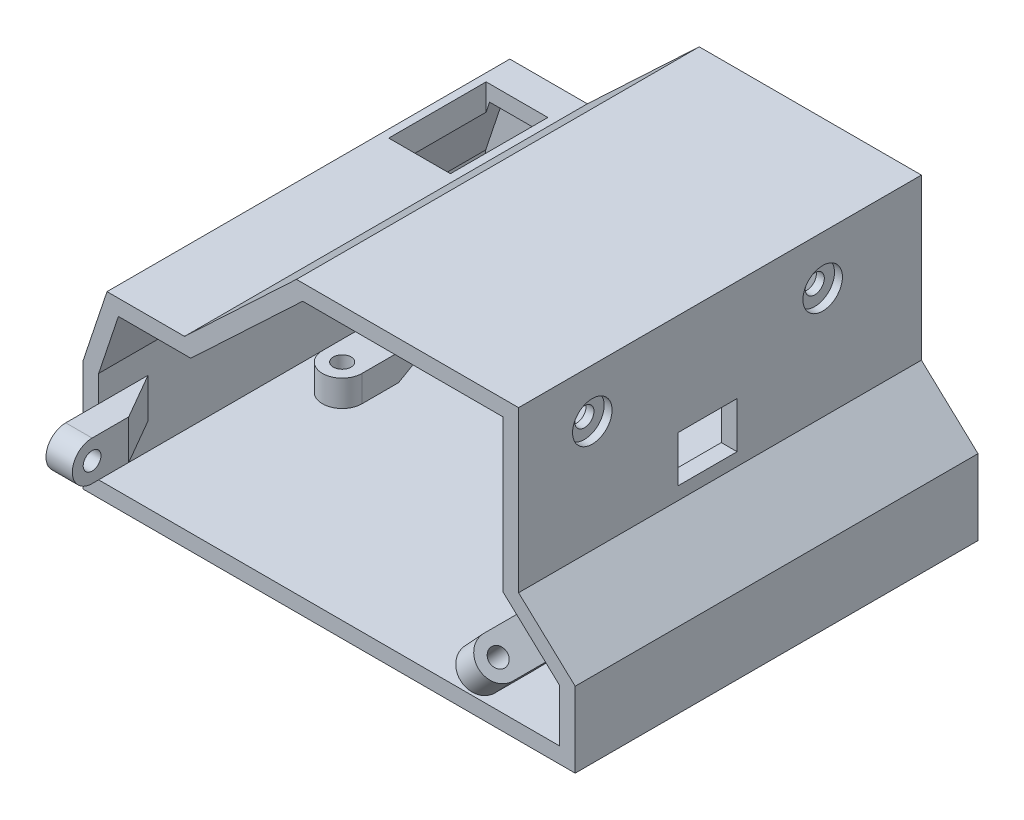
from build123d import *
from OCP.BRepFilletAPI import BRepFilletAPI_MakeChamfer

# Parameters (mm, degrees)
BOSS_EXTRUDE1_DEPTH                                = 104
SHELL1_START                                       = -8.6
SHELL1_OUTLINE_W                                   = 16
SHELL1_OUTLINE_H                                   = 108.8
SHELL1_DEPTH                                       = 2.4
SHELL1_START_2                                     = -56.951785259
SHELL1_2_OUTLINE_W                                 = 43.8
SHELL1_2_OUTLINE_H                                 = 108.8
SHELL1_2_DEPTH                                     = 50.751785259
SHELL1_START_3                                     = -72.4
SHELL1_3_OUTLINE_W                                 = 27.8
SHELL1_3_OUTLINE_H                                 = 108.8
SHELL1_3_DEPTH                                     = 74.8
SHELL1_4_DEPTH                                     = 104
SHELL1_START_4                                     = -2.4
SHELL1_5_DEPTH                                     = 108.8
SPLIT1_SURFACE_1_BACK                              = 140.108
SPLIT1_SURFACE_1_DEPTH                             = 280.216
SPLIT1_SURFACE_2_BACK                              = 140.108
SPLIT1_SURFACE_2_DEPTH                             = 280.216
BOSS_EXTRUDE2_DEPTH                                = 4
BOSS_EXTRUDE3_DEPTH                                = 4
BOSS_EXTRUDE4_DEPTH                                = 4
CHAMFER1_SIZE                                      = 4
CHAMFER1_SIZE_2                                    = 6.92820323
CBORE_START                                        = 6.157493905
CBORE_FOR_M2_5_PAN_HEAD_MACHINE_SCRE_2_R           = 3
CBORE_FOR_M2_5_PAN_HEAD_MACHINE_SCREW1_4_DEPTH     = 2.1
CBORE_START_2                                      = 5.857493905
CBORE_FOR_M2_5_PAN_HEAD_MACHINE_SCRE_3_R           = 1.35
CBORE_FOR_M2_5_PAN_HEAD_MACHINE_SCREW1_5_DEPTH     = 0.3
CBORE_START_3                                      = 39.3
CBORE_FOR_M2_5_PAN_HEAD_MACHINE_SCRE_4_R           = 3
CBORE_FOR_M2_5_PAN_HEAD_MACHINE_SCREW1_6_DEPTH     = 2.1
CBORE_START_4                                      = 38
CBORE_FOR_M2_5_PAN_HEAD_MACHINE_SCRE_5_R           = 1.35
CBORE_FOR_M2_5_PAN_HEAD_MACHINE_SCREW1_7_DEPTH     = 1.3
CBORE_START_5                                      = -72.4
CBORE_FOR_M2_5_PAN_HEAD_MACHINE_SCRE_6_R           = 3
CBORE_FOR_M2_5_PAN_HEAD_MACHINE_SCREW1_8_DEPTH     = 2.1
CBORE_START_6                                      = -70.3
CBORE_FOR_M2_5_PAN_HEAD_MACHINE_SCRE_7_R           = 1.35
CBORE_FOR_M2_5_PAN_HEAD_MACHINE_SCREW1_9_DEPTH     = 0.3
CUT_EXTRUDE1_REACH                                 = 104.356
SKETCH12_W                                         = 9.37803524
SKETCH12_H                                         = 14.8
CUT_EXTRUDE2_REACH                                 = 110.495
SKETCH13_W                                         = 14.8
SKETCH13_H                                         = 10.789494281
CUT_EXTRUDE3_REACH                                 = 104.755
SKETCH14_W                                         = 9
SKETCH14_H                                         = 7
CBORE_FOR_M2_5_PAN_HEAD_MACHINE_SCREW2_D           = 2.9
CBORE_FOR_M2_5_PAN_HEAD_MACHINE_SCREW2_DEPTH       = 10
CBORE_FOR_M2_5_PAN_HEAD_MACHINE_SCREW2_CBORE_D     = 6
CBORE_FOR_M2_5_PAN_HEAD_MACHINE_SCREW2_CBORE_DEPTH = 1.2


with BuildPart() as part:
    # Sketch1 → Boss-Extrude1 (new body)
    with BuildSketch(Plane.XY):
        Polygon((-39, 39), (-56, 23), (-67, 23), (-70, 14.000026796), (-70, 0), (0, 0), (0, 8), (-8.6, 16), (-8.6, 39), align=None)
    extrude(amount=BOSS_EXTRUDE1_DEPTH)

    # Shell1: read off the stored shape, not the designer's step
    # Shell1 outline → Shell1 (add)
    with BuildSketch(Plane.YZ.offset(SHELL1_START)):
        with Locations((33.4, 52)):
            Rectangle(SHELL1_OUTLINE_W, SHELL1_OUTLINE_H)
    extrude(amount=SHELL1_DEPTH)

    # Shell1 2 outline → Shell1 2 (add)
    with BuildSketch(Plane.YZ.offset(SHELL1_START_2)):
        with Locations((19.5, 52)):
            Rectangle(SHELL1_2_OUTLINE_W, SHELL1_2_OUTLINE_H)
    extrude(amount=SHELL1_2_DEPTH)

    # Shell1 3 outline → Shell1 3 (add)
    with BuildSketch(Plane.YZ.offset(SHELL1_START_3)):
        with Locations((11.5, 52)):
            Rectangle(SHELL1_3_OUTLINE_W, SHELL1_3_OUTLINE_H)
    extrude(amount=SHELL1_3_DEPTH)

    # Shell1 4 outline → Shell1 4 (cut)
    with BuildSketch(Plane.XY):
        Polygon((-6.2, 25.4), (-6.2, 17.045294183), (2.4, 9.045294183), (2.4, 25.4), align=None)
        Polygon((-72.4, 14.389494281), (-68.729820499, 25.4), (-72.4, 25.4), align=None)
        Polygon((-56.951785259, 25.4), (-39.951785259, 41.4), (-56.951785259, 41.4), align=None)
        Polygon((0, 0), (0, 8), (-8.6, 16), (-8.6, 39), (-39, 39), (-56, 23), (-67, 23), (-70, 14.000026796), (-70, 0), align=None)
    extrude(amount=SHELL1_4_DEPTH, mode=Mode.SUBTRACT)

    # Shell1 5 outline → Shell1 5 (cut)
    with BuildSketch(Plane.XY.offset(SHELL1_START_4)):
        Polygon((-6.2, 25.4), (-6.2, 17.045294183), (2.4, 9.045294183), (2.4, 25.4), align=None)
        Polygon((-72.4, 14.389494281), (-68.729820499, 25.4), (-72.4, 25.4), align=None)
        Polygon((-56.951785259, 25.4), (-39.951785259, 41.4), (-56.951785259, 41.4), align=None)
    extrude(amount=SHELL1_5_DEPTH, mode=Mode.SUBTRACT)


with BuildPart() as body_2:
    # Split1: the piece behind the surface
    add(part.part)
    # Split1 surface: a surface, the sketch's curves swept straight by 280.216 mm
    with BuildLine(Plane(origin=(0, 0, 0), x_dir=(0, 0, -1), z_dir=(1, 0, 0)).offset(-SPLIT1_SURFACE_1_BACK), mode=Mode.PRIVATE) as split1_surface_1_path:
        Line((-58.8, -2.4), (-58.8, 41.4))
    split1_surface_1 = Shell.extrude(split1_surface_1_path.wire(), (1 * SPLIT1_SURFACE_1_DEPTH, 0 * SPLIT1_SURFACE_1_DEPTH, 0 * SPLIT1_SURFACE_1_DEPTH))
    split(bisect_by=split1_surface_1, keep=Keep.BOTTOM)

    # Sketch3 → Boss-Extrude2 (add)
    with BuildSketch(Plane(origin=(3.989562192, 4.288779356, 0), x_dir=(0.7321867381630838, -0.6811039424772873, 0), z_dir=(-0.6811039424772873, -0.7321867381630838, 0))):
        with BuildLine():
            Line((-14.321650284, 51.3), (-8.321650284, 51.3))
            Line((-8.321650284, 51.3), (-8.321650284, 63.8))
            ThreePointArc((-8.321650284, 63.8), (-11.321650284, 66.8), (-14.321650284, 63.8))
            Line((-14.321650284, 63.8), (-14.321650284, 51.3))
        make_face()
    extrude(amount=BOSS_EXTRUDE2_DEPTH)

    # Sketch4 → Boss-Extrude3 (add)
    with BuildSketch(Plane.XZ.offset(-39)):
        with BuildLine():
            Line((-31, 51.3), (-25, 51.3))
            Line((-25, 51.3), (-25, 63.8))
            ThreePointArc((-25, 63.8), (-28, 66.8), (-31, 63.8))
            Line((-31, 63.8), (-31, 51.3))
        make_face()
    extrude(amount=BOSS_EXTRUDE3_DEPTH)

    # Sketch5 → Boss-Extrude4 (add)
    with BuildSketch(Plane(origin=(-70, 0, 0), x_dir=(0, 0, -1), z_dir=(1, 0, 0))):
        with BuildLine():
            Line((-51.3, 10.000013398), (-63.8, 10.000013398))
            ThreePointArc((-63.8, 10.000013398), (-66.8, 7.000013398), (-63.8, 4.000013398))
            Line((-63.8, 4.000013398), (-51.3, 4.000013398))
            Line((-51.3, 4.000013398), (-51.3, 10.000013398))
        make_face()
    extrude(amount=BOSS_EXTRUDE4_DEPTH)

    # Chamfer1
    chamfer1_edges_1 = [body_2.edges().sort_by_distance(p)[0] for p in [
        (-7.02441577, 9.071253047, 51.3),
    ]]
    chamfer1_side_1 = [body_2.faces().sort_by_distance(p)[0] for p in [
        (-6.969927455, 9.129827986, 51.3),
    ]]
    chamfer1_edges_2 = [body_2.edges().sort_by_distance(p)[0] for p in [
        (-28, 35, 51.3),
    ]]
    chamfer1_side_2 = [body_2.faces().sort_by_distance(p)[0] for p in [
        (-28, 35.08, 51.3),
    ]]
    chamfer1_edges_3 = [body_2.edges().sort_by_distance(p)[0] for p in [
        (-66, 7.000013398, 51.3),
    ]]
    chamfer1_side_3 = [body_2.faces().sort_by_distance(p)[0] for p in [
        (-66.08, 7.000013398, 51.3),
    ]]
    chamfer1 = BRepFilletAPI_MakeChamfer(body_2.part.solid().wrapped)
    for e in chamfer1_edges_1:
        chamfer1.Add(CHAMFER1_SIZE - 0.0001, CHAMFER1_SIZE_2 - 0.0001, e.wrapped, chamfer1_side_1[0].wrapped)
    for e in chamfer1_edges_2:
        chamfer1.Add(CHAMFER1_SIZE - 0.0001, CHAMFER1_SIZE_2 - 0.0001, e.wrapped, chamfer1_side_2[0].wrapped)
    for e in chamfer1_edges_3:
        chamfer1.Add(CHAMFER1_SIZE - 0.0001, CHAMFER1_SIZE_2 - 0.0001, e.wrapped, chamfer1_side_3[0].wrapped)
    add(Compound.cast(chamfer1.Shape()), mode=Mode.REPLACE)  # a hair under: the kernel refuses the full size

    # CBORE for M2.5 Pan Head Machine Screw1: read off the stored shape, not the designer's step
    # CBORE for M2.5 Pan Head Machine Screw1: loft between two sections, ruled curve by curve
    cbore_for_m2_5_pan_head_machine_screw1_from = [
        Edge.make_three_point_arc((-8.012867866, 9.99074337, 63.8), (-7.02441577, 9.071253047, 65.15), (-6.035963673, 8.151762725, 63.8)),
        Edge.make_three_point_arc((-6.035963673, 8.151762725, 63.8), (-7.02441577, 9.071253047, 62.45), (-8.012867866, 9.99074337, 63.8)),
    ]
    cbore_for_m2_5_pan_head_machine_screw1_to = [
        Edge.make_three_point_arc((-5.288452097, 12.919490322, 63.8), (-4.3, 12, 65.15), (-3.311547903, 11.080509678, 63.8)),
        Edge.make_three_point_arc((-3.311547903, 11.080509678, 63.8), (-4.3, 12, 62.45), (-5.288452097, 12.919490322, 63.8)),
    ]
    cbore_for_m2_5_pan_head_machine_screw1 = Solid(Shell([*[Face.make_surface_from_curves(cbore_for_m2_5_pan_head_machine_screw1_from[k], cbore_for_m2_5_pan_head_machine_screw1_to[k]) for k in range(2)], Face(Wire(cbore_for_m2_5_pan_head_machine_screw1_from)), Face(Wire(cbore_for_m2_5_pan_head_machine_screw1_to))]))
    add(cbore_for_m2_5_pan_head_machine_screw1, mode=Mode.SUBTRACT)

    # CBORE for M2.5 Pan Head Machine Screw1 2: loft between two sections, ruled curve by curve
    cbore_for_m2_5_pan_head_machine_screw1_2_from = [
        Edge.make_three_point_arc((-29.35, 35, 63.8), (-28, 35, 65.15), (-26.65, 35, 63.8)),
        Edge.make_three_point_arc((-26.65, 35, 63.8), (-28, 35, 62.45), (-29.35, 35, 63.8)),
    ]
    cbore_for_m2_5_pan_head_machine_screw1_2_to = [
        Edge.make_three_point_arc((-29.35, 39, 63.8), (-28, 39, 65.15), (-26.65, 39, 63.8)),
        Edge.make_three_point_arc((-26.65, 39, 63.8), (-28, 39, 62.45), (-29.35, 39, 63.8)),
    ]
    cbore_for_m2_5_pan_head_machine_screw1_2 = Solid(Shell([*[Face.make_surface_from_curves(cbore_for_m2_5_pan_head_machine_screw1_2_from[k], cbore_for_m2_5_pan_head_machine_screw1_2_to[k]) for k in range(2)], Face(Wire(cbore_for_m2_5_pan_head_machine_screw1_2_from)), Face(Wire(cbore_for_m2_5_pan_head_machine_screw1_2_to))]))
    add(cbore_for_m2_5_pan_head_machine_screw1_2, mode=Mode.SUBTRACT)

    # CBORE for M2.5 Pan Head Machine Screw1 3: loft between two sections, ruled curve by curve
    cbore_for_m2_5_pan_head_machine_screw1_3_from = [
        Edge.make_three_point_arc((-66, 7.000013398, 65.15), (-66, 8.350013398, 63.8), (-66, 7.000013398, 62.45)),
        Edge.make_three_point_arc((-66, 7.000013398, 62.45), (-66, 5.650013398, 63.8), (-66, 7.000013398, 65.15)),
    ]
    cbore_for_m2_5_pan_head_machine_screw1_3_to = [
        Edge.make_three_point_arc((-70, 7.000013398, 65.15), (-70, 8.350013398, 63.8), (-70, 7.000013398, 62.45)),
        Edge.make_three_point_arc((-70, 7.000013398, 62.45), (-70, 5.650013398, 63.8), (-70, 7.000013398, 65.15)),
    ]
    cbore_for_m2_5_pan_head_machine_screw1_3 = Solid(Shell([*[Face.make_surface_from_curves(cbore_for_m2_5_pan_head_machine_screw1_3_from[k], cbore_for_m2_5_pan_head_machine_screw1_3_to[k]) for k in range(2)], Face(Wire(cbore_for_m2_5_pan_head_machine_screw1_3_from)), Face(Wire(cbore_for_m2_5_pan_head_machine_screw1_3_to))]))
    add(cbore_for_m2_5_pan_head_machine_screw1_3, mode=Mode.SUBTRACT)

    # Sketch12 → Cut-Extrude1 (cut, up to next)
    with BuildSketch(Plane(origin=(0, 25.4, 0), x_dir=(1, 0, 0), z_dir=(0, 1, 0)), mode=Mode.PRIVATE) as cut_extrude1_sk1:
        with Locations((-62.840802879, -9.8)):
            Rectangle(SKETCH12_W, SKETCH12_H)
    cut_extrude1_tool1 = extrude(cut_extrude1_sk1.sketch, amount=-CUT_EXTRUDE1_REACH, mode=Mode.PRIVATE) & body_2.part
    add(cut_extrude1_tool1.solids().sort_by_distance((-62.840803, 25.4, 9.8))[0], mode=Mode.SUBTRACT)

    # Sketch13 → Cut-Extrude2 (cut, up to next)
    with BuildSketch(Plane.ZY.offset(72.4), mode=Mode.PRIVATE) as cut_extrude2_sk1:
        with Locations((9.8, 7.794747141)):
            Rectangle(SKETCH13_W, SKETCH13_H)
    cut_extrude2_tool1 = extrude(cut_extrude2_sk1.sketch, amount=-CUT_EXTRUDE2_REACH, mode=Mode.PRIVATE) & body_2.part
    add(cut_extrude2_tool1.solids().sort_by_distance((-72.4, 7.794747, 9.8))[0], mode=Mode.SUBTRACT)

    # Sketch14 → Cut-Extrude3 (cut, up to next)
    with BuildSketch(Plane(origin=(-6.2, 0, 0), x_dir=(0, 0, -1), z_dir=(1, 0, 0)), mode=Mode.PRIVATE) as cut_extrude3_sk1:
        with Locations((-30.1, 22.5)):
            Rectangle(SKETCH14_W, SKETCH14_H)
    cut_extrude3_tool1 = extrude(cut_extrude3_sk1.sketch, amount=-CUT_EXTRUDE3_REACH, mode=Mode.PRIVATE) & body_2.part
    add(cut_extrude3_tool1.solids().sort_by_distance((-6.2, 22.5, 30.1))[0], mode=Mode.SUBTRACT)

    # CBORE for M2.5 Pan Head Machine Screw2
    with Locations(Plane(origin=(-6.2, 0, 0), x_dir=(0, 0, -1), z_dir=(1, 0, 0))):
        with Locations((-47.6, 34), (-12.6, 34)):
            CounterBoreHole(CBORE_FOR_M2_5_PAN_HEAD_MACHINE_SCREW2_D / 2, CBORE_FOR_M2_5_PAN_HEAD_MACHINE_SCREW2_CBORE_D / 2, CBORE_FOR_M2_5_PAN_HEAD_MACHINE_SCREW2_CBORE_DEPTH, depth=CBORE_FOR_M2_5_PAN_HEAD_MACHINE_SCREW2_DEPTH)


with BuildPart() as part_1:
    add(part.part)

    # Split1: split by a surface, the side it looks to stays
    # Split1 surface: a surface, the sketch's curves swept straight by 280.216 mm
    with BuildLine(Plane(origin=(0, 0, 0), x_dir=(0, 0, -1), z_dir=(1, 0, 0)).offset(-SPLIT1_SURFACE_2_BACK), mode=Mode.PRIVATE) as split1_surface_2_path:
        Line((-58.8, -2.4), (-58.8, 41.4))
    split1_surface_2 = Shell.extrude(split1_surface_2_path.wire(), (1 * SPLIT1_SURFACE_2_DEPTH, 0 * SPLIT1_SURFACE_2_DEPTH, 0 * SPLIT1_SURFACE_2_DEPTH))
    split(bisect_by=split1_surface_2, keep=Keep.TOP)

    # CBORE for M2.5 Pan Head Machine Scre 2 → CBORE for M2.5 Pan Head Machine Screw1 4 (cut)
    with BuildSketch(Plane(origin=(0, 0, 0), x_dir=(0.732186738163084, -0.681103942477287, 0), z_dir=(0.681103942477287, 0.732186738163084, 0)).offset(CBORE_START)):
        with Locations((-11.321650284, -63.8)):
            Circle(CBORE_FOR_M2_5_PAN_HEAD_MACHINE_SCRE_2_R)
    extrude(amount=CBORE_FOR_M2_5_PAN_HEAD_MACHINE_SCREW1_4_DEPTH, mode=Mode.SUBTRACT)

    # CBORE for M2.5 Pan Head Machine Scre 3 → CBORE for M2.5 Pan Head Machine Screw1 5 (cut)
    with BuildSketch(Plane(origin=(0, 0, 0), x_dir=(0.732186738163084, -0.681103942477287, 0), z_dir=(0.681103942477287, 0.732186738163084, 0)).offset(CBORE_START_2)):
        with Locations((-11.321650284, -63.8)):
            Circle(CBORE_FOR_M2_5_PAN_HEAD_MACHINE_SCRE_3_R)
    extrude(amount=CBORE_FOR_M2_5_PAN_HEAD_MACHINE_SCREW1_5_DEPTH, mode=Mode.SUBTRACT)

    # CBORE for M2.5 Pan Head Machine Scre 4 → CBORE for M2.5 Pan Head Machine Screw1 6 (cut)
    with BuildSketch(Plane(origin=(0, 0, 0), x_dir=(1, 0, 0), z_dir=(0, 1, 0)).offset(CBORE_START_3)):
        with Locations((-28, -63.8)):
            Circle(CBORE_FOR_M2_5_PAN_HEAD_MACHINE_SCRE_4_R)
    extrude(amount=CBORE_FOR_M2_5_PAN_HEAD_MACHINE_SCREW1_6_DEPTH, mode=Mode.SUBTRACT)

    # CBORE for M2.5 Pan Head Machine Scre 5 → CBORE for M2.5 Pan Head Machine Screw1 7 (cut)
    with BuildSketch(Plane(origin=(0, 0, 0), x_dir=(1, 0, 0), z_dir=(0, 1, 0)).offset(CBORE_START_4)):
        with Locations((-28, -63.8)):
            Circle(CBORE_FOR_M2_5_PAN_HEAD_MACHINE_SCRE_5_R)
    extrude(amount=CBORE_FOR_M2_5_PAN_HEAD_MACHINE_SCREW1_7_DEPTH, mode=Mode.SUBTRACT)

    # CBORE for M2.5 Pan Head Machine Scre 6 → CBORE for M2.5 Pan Head Machine Screw1 8 (cut)
    with BuildSketch(Plane.YZ.offset(CBORE_START_5)):
        with Locations((7.000013398, 63.8)):
            Circle(CBORE_FOR_M2_5_PAN_HEAD_MACHINE_SCRE_6_R)
    extrude(amount=CBORE_FOR_M2_5_PAN_HEAD_MACHINE_SCREW1_8_DEPTH, mode=Mode.SUBTRACT)

    # CBORE for M2.5 Pan Head Machine Scre 7 → CBORE for M2.5 Pan Head Machine Screw1 9 (cut)
    with BuildSketch(Plane.YZ.offset(CBORE_START_6)):
        with Locations((7.000013398, 63.8)):
            Circle(CBORE_FOR_M2_5_PAN_HEAD_MACHINE_SCRE_7_R)
    extrude(amount=CBORE_FOR_M2_5_PAN_HEAD_MACHINE_SCREW1_9_DEPTH, mode=Mode.SUBTRACT)


solid = body_2.part
